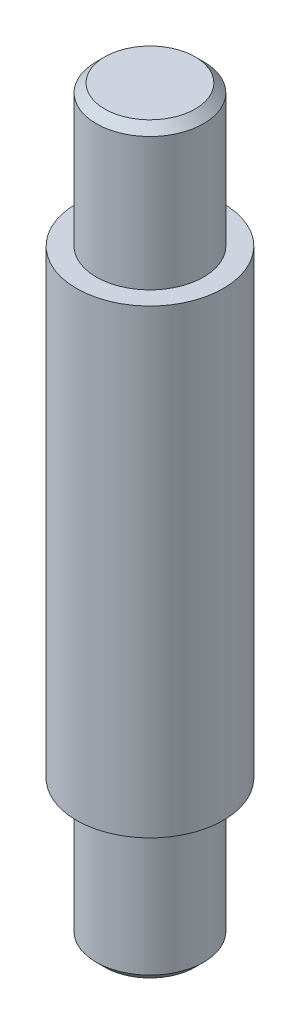
from build123d import *


with BuildPart() as part:
    # Sketch1 → Revolve1 (revolve)
    with BuildSketch(Plane(origin=(0, 0, 0), x_dir=(0, 0, -1), z_dir=(1, 0, 0))):
        Polygon((0, 33.401), (-4.064, 33.401), (-4.826, 32.639), (-4.826, 20.701), (-6.604, 20.701), (-6.604, -20.701), (-4.826, -20.701), (-4.826, -32.639), (-4.064, -33.401), (0, -33.401), align=None)
    revolve(axis=Axis((0, 33.401, 0), (0, -1, 0)))


solid = part.part
